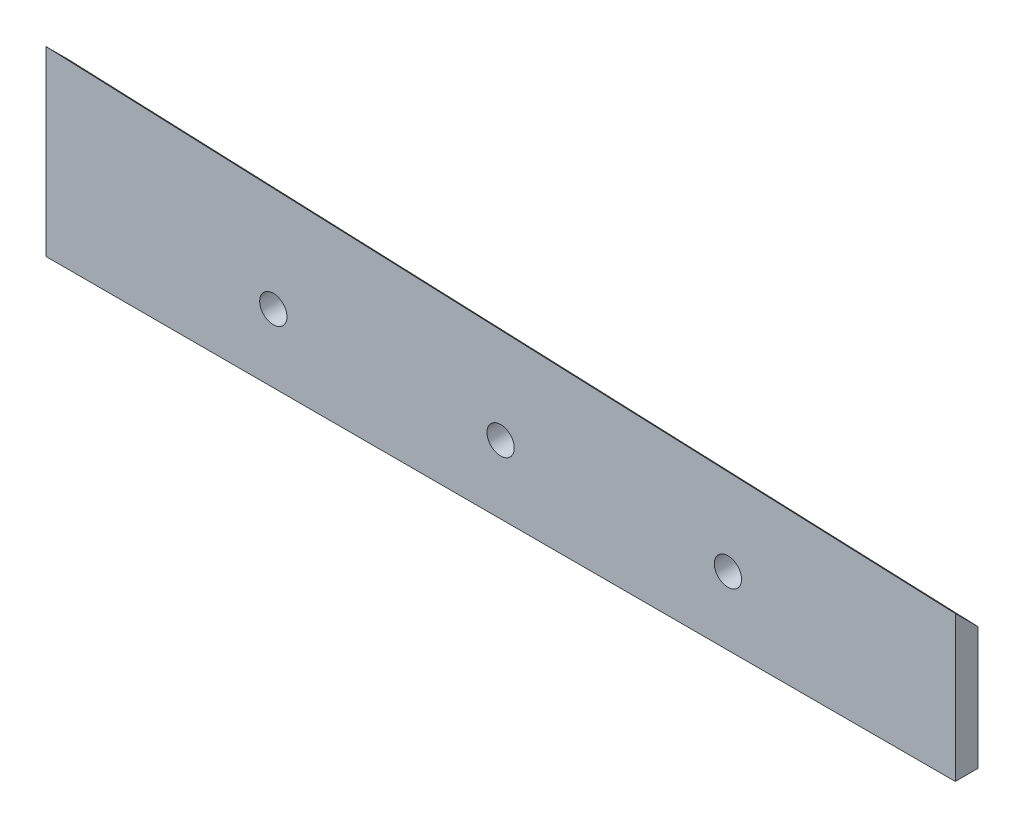
from build123d import *

# Parameters (mm, degrees)
SKETCH1_W           = 5
SKETCH1_H           = 40
BOSS_EXTRUDE1_DEPTH = 200
CUT_EXTRUDE2_DEPTH  = 5
CHAMFER1_SIZE       = 5
SKETCH2_R           = 3
CUT_EXTRUDE1_DEPTH  = 5
LPATTERN1_COUNT     = 3
LPATTERN1_PITCH     = 50


with BuildPart() as part:
    # Sketch1 → Boss-Extrude1 (new body)
    with BuildSketch(Plane(origin=(0, 0, 0), x_dir=(0, 0, -1), z_dir=(1, 0, 0))):
        with Locations((418.326871087, -169.232517464)):
            Rectangle(SKETCH1_W, SKETCH1_H)
    extrude(amount=BOSS_EXTRUDE1_DEPTH)

    # Sketch3 → Cut-Extrude2 (cut)
    with BuildSketch(Plane.XY.offset(-415.826871087)):
        Polygon((0, -149.232517464), (200, -149.232517464), (200, -157.232517464), align=None)
    extrude(amount=-CUT_EXTRUDE2_DEPTH, mode=Mode.SUBTRACT)

    # Chamfer1
    chamfer1_edges = [part.edges().sort_by_distance(p)[0] for p in [
        (100, -153.232517464, -420.826871087),
    ]]
    chamfer(chamfer1_edges, length=CHAMFER1_SIZE - 0.0001)  # a hair under: the kernel refuses the full size

    # Sketch2 → Cut-Extrude1 (cut)
    with BuildSketch(Plane(origin=(0, 0, -420.826871087), x_dir=(-1, 0, 0), z_dir=(0, 0, -1))):
        with Locations((-50, -174.232517464)):
            Circle(SKETCH2_R)
    cut_extrude1 = extrude(amount=-CUT_EXTRUDE1_DEPTH, mode=Mode.SUBTRACT)

    # LPattern1: Cut-Extrude1 ×3
    with Locations(*[(i * LPATTERN1_PITCH, 0, 0) for i in range(1, LPATTERN1_COUNT)]):
        add(cut_extrude1, mode=Mode.SUBTRACT)


solid = part.part
